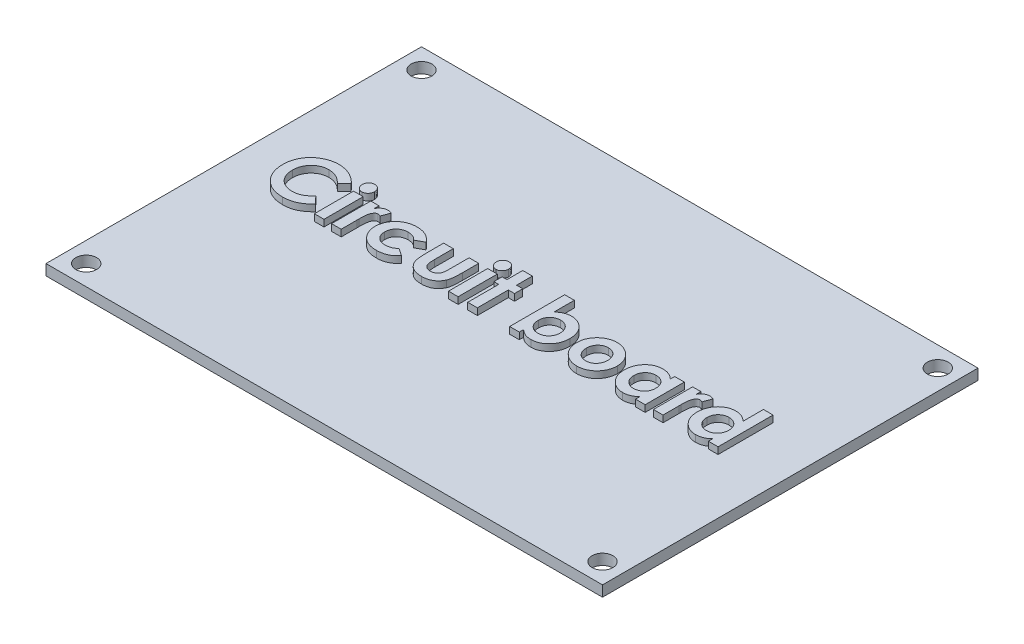
from build123d import *

# Parameters (mm, degrees)
SKETCH_1_W      = 83
SKETCH_1_H      = 56
SKETCH_1_R      = 1.55
EXTRUDE_1_DEPTH = 1.6
SKETCH_2_W      = 1.435897435
SKETCH_2_H      = 5.846153846
EXTRUDE_2_DEPTH = 1


with BuildPart() as part:
    # ｽｹｯﾁ1 → ﾎﾞｽ - 押し出し1 (new body)
    with BuildSketch(Plane(origin=(0, 0, 0), x_dir=(1, 0, 0), z_dir=(0, 1, 0))):
        Rectangle(SKETCH_1_W, SKETCH_1_H)
        with Locations((-38.5, 25)):
            Circle(SKETCH_1_R, mode=Mode.SUBTRACT)
        with Locations((38.5, 25)):
            Circle(SKETCH_1_R, mode=Mode.SUBTRACT)
        with Locations((38.5, -25)):
            Circle(SKETCH_1_R, mode=Mode.SUBTRACT)
        with Locations((-38.5, -25)):
            Circle(SKETCH_1_R, mode=Mode.SUBTRACT)
    extrude(amount=EXTRUDE_1_DEPTH)

    # ｽｹｯﾁ2 → ﾎﾞｽ - 押し出し2 (add)
    # profile 1 of 14: a face of its own
    with BuildSketch(Plane(origin=(0, 1.6, 0), x_dir=(1, 0, 0), z_dir=(0, 1, 0))):
        with BuildLine():
            Line((-28.050815975, 4.060532722), (-29.10370059, 3.054122466))
            add(Edge.make_bspline(
                [(-29.10370059, 3.054122466), (-29.193014841, 3.146473551), (-29.367473554, 3.326864152), (-29.648592194, 3.565685412), (-29.940945343, 3.764710617), (-30.238845856, 3.932328379), (-30.547652099, 4.059143161), (-30.86379343, 4.151555229), (-31.189288505, 4.207895374), (-31.409571052, 4.214341684), (-31.520367257, 4.217584004)],
                knots=[0, 0, 0, 0, 1.115251505, 2.178435587, 3.19620269, 4.182487026, 5.141301733, 6.088180966, 7.038406374, 8, 8, 8, 8], degree=3))
            add(Edge.make_bspline(
                [(-31.520367257, 4.217584004), (-31.612895552, 4.215022458), (-31.795489948, 4.209967528), (-32.063586371, 4.172909904), (-32.320034455, 4.109891803), (-32.565712062, 4.023041187), (-32.799896276, 3.910661099), (-33.023078093, 3.772838518), (-33.234707268, 3.610818179), (-33.431988301, 3.425438382), (-33.612454057, 3.222897024), (-33.771907043, 3.006785877), (-33.905474497, 2.777600041), (-34.015091133, 2.537660542), (-34.100478256, 2.28585682), (-34.161455389, 2.0223584), (-34.196722933, 1.746851475), (-34.201986851, 1.559563921), (-34.204662128, 1.464378876)],
                knots=[0, 0, 0, 0, 1.035432265, 2.043311493, 3.022114605, 3.98653278, 4.95457646, 5.923598177, 6.917315552, 7.932509744, 8.948865224, 9.949768934, 10.933144597, 11.912367597, 12.897413939, 13.903909035, 14.934704909, 16, 16, 16, 16], degree=3))
            add(Edge.make_bspline(
                [(-34.204662128, 1.464378876), (-34.203891144, 1.397571352), (-34.202371518, 1.265892349), (-34.18573652, 1.071102557), (-34.158950252, 0.882110409), (-34.120183886, 0.699202177), (-34.071706163, 0.522219351), (-34.014830757, 0.349635109), (-33.943481395, 0.183834176), (-33.864282528, 0.022890884), (-33.772175158, -0.128803229), (-33.672866422, -0.273456156), (-33.565182311, -0.410358822), (-33.448425349, -0.538951564), (-33.320952328, -0.657224767), (-33.186057953, -0.768735045), (-33.041466743, -0.87069092), (-32.890182223, -0.965651086), (-32.730897487, -1.04814379), (-32.567934299, -1.122866242), (-32.398821808, -1.183551983), (-32.225619061, -1.232470227), (-32.048945023, -1.274067888), (-31.867071658, -1.299680845), (-31.68157558, -1.319077239), (-31.556211367, -1.320274853), (-31.493123667, -1.320877534)],
                knots=[0, 0, 0, 0, 1.103660481, 2.175337485, 3.227646561, 4.255952547, 5.262355991, 6.258840057, 7.255597736, 8.242457506, 9.22035537, 10.185017736, 11.140346927, 12.096287581, 13.051739095, 14.01125915, 14.986044842, 15.97314143, 16.960198552, 17.947847494, 18.933482797, 19.925264591, 20.920966487, 21.929612487, 22.958107872, 24, 24, 24, 24], degree=3))
            add(Edge.make_bspline(
                [(-31.493123667, -1.320877534), (-31.386116085, -1.317782307), (-31.175874014, -1.311700991), (-30.867313544, -1.264145957), (-30.573286156, -1.185920619), (-30.33835968, -1.09354104), (-30.154300991, -1.002315006), (-30.014179832, -0.917935417), (-29.869283633, -0.823547582), (-29.722018996, -0.715589203), (-29.570729485, -0.595355822), (-29.418085709, -0.460214106), (-29.260179961, -0.314614076), (-29.15673747, -0.210696474), (-29.10370059, -0.157415996)],
                knots=[0, 0, 0, 0, 1.404581149, 2.759636711, 4.088442092, 5.392261763, 6.066678138, 6.783632037, 7.538459478, 8.336747902, 9.180226004, 10.074962426, 11.012997595, 12, 12, 12, 12], degree=3))
            Line((-29.10370059, -0.157415996), (-28.082867257, -1.22953138))
            add(Edge.make_bspline(
                [(-28.082867257, -1.22953138), (-28.154626345, -1.298812528), (-28.29468474, -1.434034511), (-28.505958941, -1.626037109), (-28.716967244, -1.798572787), (-28.922612129, -1.957903835), (-29.126262275, -2.099388551), (-29.327896083, -2.223168239), (-29.525230971, -2.332373466), (-29.722364662, -2.425162539), (-29.920523822, -2.503950099), (-30.124406312, -2.571781017), (-30.334635418, -2.629163533), (-30.552495124, -2.675463688), (-30.775953368, -2.712590161), (-31.007101422, -2.737650316), (-31.244473692, -2.754497424), (-31.405486981, -2.756011276), (-31.486713411, -2.75677497)],
                knots=[0, 0, 0, 0, 1.244526981, 2.429050516, 3.560637417, 4.644440555, 5.67424972, 6.652764056, 7.595344123, 8.486817594, 9.369275933, 10.254498637, 11.166417451, 12.086725134, 13.032340136, 13.991389299, 14.986715468, 16, 16, 16, 16], degree=3))
            add(Edge.make_bspline(
                [(-31.486713411, -2.75677497), (-31.6359163, -2.752971491), (-31.92786488, -2.745529139), (-32.355707912, -2.690386353), (-32.762147308, -2.597940444), (-33.148171859, -2.46719643), (-33.513658817, -2.300177079), (-33.858514681, -2.095419197), (-34.182183618, -1.853466794), (-34.482051022, -1.577155787), (-34.75329536, -1.271993476), (-34.993043943, -0.944332872), (-35.191363979, -0.592563643), (-35.356033379, -0.221882545), (-35.484802684, 0.169401984), (-35.575434445, 0.581713195), (-35.631326391, 1.014652976), (-35.637441049, 1.310360826), (-35.640559564, 1.461173748)],
                knots=[0, 0, 0, 0, 1.078019885, 2.10938526, 3.111377082, 4.085535484, 5.04941344, 6.010039228, 6.978205633, 7.964457913, 8.951525778, 9.924444315, 10.892603023, 11.863865945, 12.85144698, 13.863884204, 14.910567087, 16, 16, 16, 16], degree=3))
            add(Edge.make_bspline(
                [(-35.640559564, 1.461173748), (-35.639241831, 1.559532649), (-35.636630405, 1.754455951), (-35.60918408, 2.041593767), (-35.570922306, 2.321501777), (-35.510223482, 2.591273607), (-35.437057035, 2.854543582), (-35.346064946, 3.108450266), (-35.237392541, 3.35372341), (-35.114542588, 3.590773617), (-34.975563666, 3.818047955), (-34.820308952, 4.033593778), (-34.652775309, 4.239075061), (-34.468937176, 4.431765712), (-34.271465962, 4.613357594), (-34.059470108, 4.782866625), (-33.834224662, 4.942723756), (-33.595119969, 5.088806659), (-33.346801196, 5.22094641), (-33.092400296, 5.337499314), (-32.832542302, 5.434910701), (-32.568325918, 5.515709854), (-32.298634833, 5.576020708), (-32.025394033, 5.621674079), (-31.746278567, 5.647194605), (-31.558876712, 5.651372478), (-31.464277513, 5.65348144)],
                knots=[0, 0, 0, 0, 1.071919942, 2.124283339, 3.142214191, 4.149696895, 5.136002878, 6.119640489, 7.086990633, 8.058538607, 9.028339693, 9.988281803, 10.952401235, 11.916291999, 12.888973767, 13.874849856, 14.873389453, 15.898127285, 16.927174885, 17.938320013, 18.946391617, 19.950418109, 20.947802303, 21.956882652, 22.968648068, 24, 24, 24, 24], degree=3))
            add(Edge.make_bspline(
                [(-31.464277513, 5.65348144), (-31.383574697, 5.65227253), (-31.223008148, 5.64986728), (-30.983897613, 5.629816902), (-30.746699373, 5.598327986), (-30.512262669, 5.550817917), (-30.27891057, 5.494417461), (-30.049709585, 5.420568845), (-29.821043945, 5.338250645), (-29.596499929, 5.239856045), (-29.375764109, 5.132449451), (-29.164007567, 5.010592771), (-28.957674932, 4.881784926), (-28.76133841, 4.738402506), (-28.571320195, 4.585646257), (-28.38861391, 4.422803485), (-28.21482291, 4.247159124), (-28.105761327, 4.123056014), (-28.050815975, 4.060532722)],
                knots=[0, 0, 0, 0, 0.996412454, 1.982464992, 2.961075852, 3.949442424, 4.934965278, 5.923860011, 6.921385422, 7.934793307, 8.949617135, 9.951082467, 10.950285876, 11.951772932, 12.951063433, 13.960125323, 14.972308753, 16, 16, 16, 16], degree=3))
        make_face()
    # profile 2 of 14: a face of its own
    with BuildSketch(Plane(origin=(0, 1.6, 0), x_dir=(1, 0, 0), z_dir=(0, 1, 0))):
        with BuildLine():
            add(Edge.make_bspline(
                [(-26.207867257, 5.756045543), (-26.145980087, 5.753009124), (-26.024458668, 5.747046823), (-25.850362697, 5.688927654), (-25.69057788, 5.597711354), (-25.54932367, 5.472560416), (-25.431841627, 5.323107306), (-25.342080982, 5.155784613), (-25.292079067, 4.970396457), (-25.28513454, 4.842332259), (-25.281585205, 4.776878876)],
                knots=[0, 0, 0, 0, 0.989868614, 1.943702388, 2.910836514, 3.924849579, 4.949916355, 5.946401046, 6.950409252, 8, 8, 8, 8], degree=3))
            add(Edge.make_bspline(
                [(-25.281585205, 4.776878876), (-25.285007551, 4.711907849), (-25.291676155, 4.585308708), (-25.343231807, 4.402437284), (-25.429389771, 4.235195859), (-25.547823346, 4.087962405), (-25.687546175, 3.964827097), (-25.843839572, 3.87195482), (-26.016267198, 3.817068807), (-26.135902972, 3.810608091), (-26.196649308, 3.807327594)],
                knots=[0, 0, 0, 0, 1.05296456, 2.051751585, 3.055639087, 4.085634717, 5.099016424, 6.062201612, 7.016062274, 8, 8, 8, 8], degree=3))
            add(Edge.make_bspline(
                [(-26.196649308, 3.807327594), (-26.259076701, 3.810353158), (-26.381655352, 3.816293973), (-26.557179268, 3.874549128), (-26.719095206, 3.96504704), (-26.859736656, 4.092755006), (-26.978564131, 4.243270093), (-27.064403995, 4.414488204), (-27.118098954, 4.601144039), (-27.124472498, 4.731104955), (-27.127739052, 4.797712209)],
                knots=[0, 0, 0, 0, 0.989065327, 1.942068821, 2.907541208, 3.917690034, 4.939857478, 5.938239964, 6.943311734, 8, 8, 8, 8], degree=3))
            add(Edge.make_bspline(
                [(-27.127739052, 4.797712209), (-27.124184148, 4.86157999), (-27.117201054, 4.987039024), (-27.066899621, 5.168305458), (-26.979197186, 5.332815195), (-26.862561377, 5.479532426), (-26.722547855, 5.602348828), (-26.562858958, 5.690794829), (-26.38993466, 5.746513511), (-26.269183035, 5.752835391), (-26.207867257, 5.756045543)],
                knots=[0, 0, 0, 0, 1.038616768, 2.040212704, 3.031499824, 4.052181184, 5.074969369, 6.039807101, 7.004644834, 8, 8, 8, 8], degree=3))
        make_face()
    # profile 3 of 14: a face of its own
    with BuildSketch(Plane(origin=(0, 1.6, 0), x_dir=(1, 0, 0), z_dir=(0, 1, 0))):
        with Locations((-26.204662129, 0.371430158)):
            Rectangle(SKETCH_2_W, SKETCH_2_H)
    # profile 4 of 14: a face of its own
    with BuildSketch(Plane(origin=(0, 1.6, 0), x_dir=(1, 0, 0), z_dir=(0, 1, 0))):
        with BuildLine():
            Line((-24.358508282, 3.294507081), (-23.127739052, 3.294507081))
            Line((-23.127739052, 3.294507081), (-23.127739052, 2.574955799))
            add(Edge.make_bspline(
                [(-23.127739052, 2.574955799), (-23.092922953, 2.63890252), (-23.024873443, 2.763889038), (-22.899860787, 2.931658686), (-22.756241185, 3.072949604), (-22.599175332, 3.190717018), (-22.428187193, 3.282505154), (-22.247855526, 3.347915772), (-22.059723065, 3.39042361), (-21.931385478, 3.39483937), (-21.866521103, 3.397071184)],
                knots=[0, 0, 0, 0, 1.09866127, 2.147379032, 3.14564304, 4.131443017, 5.102343063, 6.064490016, 7.021754664, 8, 8, 8, 8], degree=3))
            add(Edge.make_bspline(
                [(-21.866521103, 3.397071184), (-21.819421473, 3.394865686), (-21.723509807, 3.390374505), (-21.577326933, 3.364267199), (-21.429034896, 3.317060227), (-21.331445957, 3.274556622), (-21.281585205, 3.252840415)],
                knots=[0, 0, 0, 0, 0.931404136, 1.896671404, 2.925354185, 4, 4, 4, 4], degree=3))
            Line((-21.281585205, 3.252840415), (-21.727098026, 2.036494261))
            add(Edge.make_bspline(
                [(-21.727098026, 2.036494261), (-21.76692051, 2.05573456), (-21.841771451, 2.091898915), (-21.95044202, 2.13457658), (-22.049065067, 2.160616406), (-22.111590269, 2.164501776), (-22.140559564, 2.166301953)],
                knots=[0, 0, 0, 0, 1.214386998, 2.282580073, 3.20428172, 4, 4, 4, 4], degree=3))
            add(Edge.make_bspline(
                [(-22.140559564, 2.166301953), (-22.167912213, 2.165109061), (-22.221719586, 2.162762436), (-22.301137764, 2.142652656), (-22.375933149, 2.107973965), (-22.449710127, 2.06354712), (-22.516648513, 2.001790482), (-22.583545553, 1.930296209), (-22.642498806, 1.842027019), (-22.704711586, 1.743778928), (-22.757683543, 1.623523353), (-22.803105365, 1.479962979), (-22.843576573, 1.311436712), (-22.87142629, 1.117049761), (-22.89834416, 0.898683156), (-22.914366336, 0.654734112), (-22.926307868, 0.38597402), (-22.927038012, 0.198369776), (-22.927418539, 0.100596825)],
                knots=[0, 0, 0, 0, 0.544232178, 1.070598461, 1.618251235, 2.182094276, 2.777567932, 3.425210017, 4.127676488, 4.886675562, 5.738955394, 6.734782583, 7.883056018, 9.186093582, 10.642914445, 12.264202625, 14.053029461, 16, 16, 16, 16], degree=3))
            Line((-22.927418539, 0.100596825), (-22.922610846, -0.184659585))
            Line((-22.922610846, -0.184659585), (-22.922610846, -2.551646765))
            Line((-22.922610846, -2.551646765), (-24.358508282, -2.551646765))
            Line((-24.358508282, -2.551646765), (-24.358508282, 3.294507081))
        make_face()
    # profile 5 of 14: a face of its own
    with BuildSketch(Plane(origin=(0, 1.6, 0), x_dir=(1, 0, 0), z_dir=(0, 1, 0))):
        with BuildLine():
            Line((-14.922610846, 2.102199389), (-16.111713411, 1.448353235))
            add(Edge.make_bspline(
                [(-16.111713411, 1.448353235), (-16.166217538, 1.502934317), (-16.270988174, 1.607852878), (-16.43899631, 1.740663132), (-16.604002361, 1.850626327), (-16.772808843, 1.931773516), (-16.946924687, 1.992885128), (-17.132630039, 2.033360691), (-17.332092408, 2.060012411), (-17.470060756, 2.062470434), (-17.54120059, 2.06373785)],
                knots=[0, 0, 0, 0, 1.150764855, 2.212059359, 3.192108068, 4.105322427, 5.000809612, 5.941206042, 6.938435785, 8, 8, 8, 8], degree=3))
            add(Edge.make_bspline(
                [(-17.54120059, 2.06373785), (-17.606440728, 2.06216206), (-17.734110206, 2.059078371), (-17.920655574, 2.036045328), (-18.09794783, 1.999869201), (-18.265668725, 1.946943401), (-18.423519532, 1.877025537), (-18.572805609, 1.794288263), (-18.712076287, 1.695499971), (-18.839362938, 1.582064913), (-18.954261513, 1.457175428), (-19.056756903, 1.323975426), (-19.140724833, 1.180488914), (-19.213320316, 1.030088348), (-19.266693401, 0.869948868), (-19.305742448, 0.701523572), (-19.328000041, 0.524804999), (-19.331224774, 0.404076023), (-19.332867257, 0.342584004)],
                knots=[0, 0, 0, 0, 1.121765476, 2.195200973, 3.227634963, 4.230038321, 5.213228299, 6.192116585, 7.160777141, 8.14345191, 9.118668839, 10.075979138, 11.027630062, 11.972829041, 12.943187208, 13.923755399, 14.94248691, 16, 16, 16, 16], degree=3))
            add(Edge.make_bspline(
                [(-19.332867257, 0.342584004), (-19.331131832, 0.282696724), (-19.327743292, 0.165762568), (-19.306925245, -0.006041573), (-19.270784333, -0.169591785), (-19.216595765, -0.324023424), (-19.151644708, -0.470760132), (-19.070078072, -0.608634881), (-18.9741602, -0.738249738), (-18.863386126, -0.858478159), (-18.740676562, -0.966608872), (-18.608386031, -1.062099487), (-18.466909233, -1.143057862), (-18.314598104, -1.206591991), (-18.153935924, -1.258359015), (-17.983849785, -1.295219163), (-17.804520688, -1.315679095), (-17.682276582, -1.319117935), (-17.619726231, -1.320877534)],
                knots=[0, 0, 0, 0, 1.070556293, 2.090336998, 3.088792742, 4.058148387, 5.011235098, 5.952916408, 6.915475435, 7.888633318, 8.869583867, 9.83422472, 10.800707077, 11.776204622, 12.778807041, 13.814557445, 14.881744048, 16, 16, 16, 16], degree=3))
            add(Edge.make_bspline(
                [(-17.619726231, -1.320877534), (-17.542711757, -1.319115218), (-17.392390695, -1.315675432), (-17.173867496, -1.286500278), (-16.968240156, -1.238254831), (-16.775486868, -1.171479302), (-16.595877299, -1.084169053), (-16.42987294, -0.977526097), (-16.275767274, -0.852337124), (-16.185901339, -0.754736981), (-16.140559564, -0.705492919)],
                knots=[0, 0, 0, 0, 1.116373375, 2.178998604, 3.189797796, 4.174590301, 5.13072713, 6.078291395, 7.030403691, 8, 8, 8, 8], degree=3))
            Line((-16.140559564, -0.705492919), (-15.025174949, -1.47151856))
            add(Edge.make_bspline(
                [(-15.025174949, -1.47151856), (-15.102488053, -1.566043606), (-15.255059585, -1.752581598), (-15.521254601, -1.993022259), (-15.80776084, -2.199614213), (-16.120340561, -2.364513292), (-16.454441571, -2.49566943), (-16.812674548, -2.588383798), (-17.194433567, -2.642960796), (-17.456618944, -2.650400902), (-17.590880077, -2.654210867)],
                knots=[0, 0, 0, 0, 0.997876357, 1.969233105, 2.924898516, 3.881013542, 4.852507933, 5.855329832, 6.901747111, 8, 8, 8, 8], degree=3))
            add(Edge.make_bspline(
                [(-17.590880077, -2.654210867), (-17.711723424, -2.651417328), (-17.947743805, -2.645961237), (-18.291737646, -2.604177875), (-18.615281716, -2.533799489), (-18.919041595, -2.436058377), (-19.202740342, -2.309447036), (-19.465457896, -2.152401667), (-19.708966282, -1.969290698), (-19.928871632, -1.759249121), (-20.125077662, -1.530616597), (-20.296366234, -1.289830198), (-20.444504426, -1.041204114), (-20.560718692, -0.780600061), (-20.655697778, -0.512079995), (-20.719843671, -0.232434141), (-20.762151838, 0.056034022), (-20.766542666, 0.25161894), (-20.768764693, 0.350596825)],
                knots=[0, 0, 0, 0, 1.183377041, 2.311265848, 3.387807024, 4.421911742, 5.431260577, 6.423665966, 7.413571885, 8.409103097, 9.395976332, 10.359992013, 11.300391101, 12.225292883, 13.150239058, 14.085544813, 15.031169026, 16, 16, 16, 16], degree=3))
            add(Edge.make_bspline(
                [(-20.768764693, 0.350596825), (-20.767574337, 0.419555557), (-20.765216608, 0.556141602), (-20.745089062, 0.758987111), (-20.713777364, 0.958390413), (-20.666719577, 1.152951801), (-20.608846807, 1.343615216), (-20.538494619, 1.530342332), (-20.452888061, 1.712169606), (-20.357393688, 1.890643768), (-20.248556696, 2.061053366), (-20.129817796, 2.223323187), (-20.00134428, 2.376459405), (-19.861626909, 2.519034832), (-19.711639881, 2.652069651), (-19.553563619, 2.778262893), (-19.382282851, 2.891106483), (-19.20375196, 2.9972003), (-19.016433084, 3.091644232), (-18.8224792, 3.173161796), (-18.623389137, 3.242422723), (-18.418685685, 3.298109907), (-18.209247475, 3.344006355), (-17.993210875, 3.373134128), (-17.772363225, 3.393607414), (-17.622979977, 3.395909633), (-17.547610846, 3.397071184)],
                knots=[0, 0, 0, 0, 1.00272354, 1.986087015, 2.96193297, 3.936200312, 4.894695956, 5.858592327, 6.835334787, 7.815655071, 8.800643866, 9.773423113, 10.738352213, 11.705312252, 12.673769326, 13.65298065, 14.64420052, 15.654211674, 16.672258995, 17.692438602, 18.712115155, 19.735602823, 20.776372304, 21.827874031, 22.90408564, 24, 24, 24, 24], degree=3))
            add(Edge.make_bspline(
                [(-17.547610846, 3.397071184), (-17.477602593, 3.396279681), (-17.339531515, 3.39471867), (-17.135631743, 3.37839613), (-16.937293942, 3.350671579), (-16.744180579, 3.313993166), (-16.55570517, 3.268542225), (-16.374393787, 3.207957643), (-16.197767596, 3.139196423), (-15.970271197, 3.035374162), (-15.702094581, 2.880402632), (-15.407708505, 2.658139296), (-15.145227681, 2.39812361), (-14.997210869, 2.201365086), (-14.922610846, 2.102199389)],
                knots=[0, 0, 0, 0, 0.826738014, 1.630502179, 2.413926014, 3.191023582, 3.95155221, 4.701751672, 5.446919844, 6.189438973, 7.653650558, 9.094719814, 10.535747635, 12, 12, 12, 12], degree=3))
        make_face()
    # profile 6 of 14: a face of its own
    with BuildSketch(Plane(origin=(0, 1.6, 0), x_dir=(1, 0, 0), z_dir=(0, 1, 0))):
        with BuildLine():
            Line((-13.486713411, 3.294507081), (-12.050815975, 3.294507081))
            Line((-12.050815975, 3.294507081), (-12.050815975, 0.488417338))
            add(Edge.make_bspline(
                [(-12.050815975, 0.488417338), (-12.050688466, 0.422705489), (-12.050443746, 0.296588405), (-12.043633992, 0.115459581), (-12.034078561, -0.050174435), (-12.022154029, -0.200508955), (-12.004355901, -0.335182374), (-11.983808712, -0.453937598), (-11.960514829, -0.557630271), (-11.922636033, -0.673209581), (-11.863373973, -0.799688906), (-11.773877772, -0.933961563), (-11.665471769, -1.05006815), (-11.539620603, -1.149039054), (-11.395039023, -1.227030299), (-11.233718986, -1.279883776), (-11.057690225, -1.315406808), (-10.935086457, -1.319005898), (-10.871328795, -1.320877534)],
                knots=[0, 0, 0, 0, 1.267339619, 2.432334223, 3.495366327, 4.467371443, 5.340232306, 6.114347373, 6.791623365, 7.387877112, 8.457231658, 9.474542289, 10.487879852, 11.508108106, 12.54995813, 13.638205937, 14.771795776, 16, 16, 16, 16], degree=3))
            add(Edge.make_bspline(
                [(-10.871328795, -1.320877534), (-10.807627713, -1.318741327), (-10.684706871, -1.314619192), (-10.507506923, -1.282473691), (-10.345806914, -1.227391304), (-10.197946081, -1.152678547), (-10.068284849, -1.052688248), (-9.955394117, -0.933542712), (-9.86034277, -0.793319976), (-9.814666215, -0.688717834), (-9.79120059, -0.634980098)],
                knots=[0, 0, 0, 0, 1.116871431, 2.155171802, 3.144773418, 4.104381479, 5.046960687, 6.001340237, 6.973219418, 8, 8, 8, 8], degree=3))
            add(Edge.make_bspline(
                [(-9.79120059, -0.634980098), (-9.782589494, -0.611109314), (-9.763581493, -0.558417312), (-9.746663996, -0.467516357), (-9.728455731, -0.360313398), (-9.714052347, -0.23462373), (-9.705902404, -0.09122576), (-9.697170575, 0.070061241), (-9.692720677, 0.249076643), (-9.692143609, 0.374633578), (-9.691841616, 0.440340415)],
                knots=[0, 0, 0, 0, 0.56094539, 1.238222264, 2.041156151, 2.969685991, 4.036367568, 5.220421584, 6.545382566, 8, 8, 8, 8], degree=3))
            Line((-9.691841616, 0.440340415), (-9.691841616, 3.294507081))
            Line((-9.691841616, 3.294507081), (-8.25594418, 3.294507081))
            Line((-8.25594418, 3.294507081), (-8.25594418, 0.837776312))
            add(Edge.make_bspline(
                [(-8.25594418, 0.837776312), (-8.256192804, 0.715966391), (-8.256669492, 0.482419903), (-8.270331075, 0.147405057), (-8.289185608, -0.157190306), (-8.313466619, -0.432204831), (-8.348452556, -0.677752652), (-8.391399658, -0.893257953), (-8.438912864, -1.080144821), (-8.482484245, -1.190876582), (-8.502739052, -1.242351893)],
                knots=[0, 0, 0, 0, 1.388070971, 2.661352173, 3.82033814, 4.865898334, 5.806910977, 6.645039373, 7.370126333, 8, 8, 8, 8], degree=3))
            add(Edge.make_bspline(
                [(-8.502739052, -1.242351893), (-8.528700497, -1.297755232), (-8.579946159, -1.407116663), (-8.66886691, -1.562604399), (-8.76472846, -1.70991671), (-8.872091938, -1.845586009), (-8.988765724, -1.970991157), (-9.111451815, -2.088982918), (-9.245675356, -2.194756489), (-9.387955435, -2.291033722), (-9.540277372, -2.37649821), (-9.701597874, -2.452234223), (-9.873660266, -2.51387035), (-10.054972561, -2.566115662), (-10.246370492, -2.605077678), (-10.44746851, -2.634588433), (-10.65848717, -2.649839703), (-10.802397988, -2.652729939), (-10.876136487, -2.654210867)],
                knots=[0, 0, 0, 0, 0.997311338, 1.968606903, 2.91805772, 3.860812155, 4.785445165, 5.709667791, 6.633356648, 7.568312411, 8.508286151, 9.478643871, 10.470653671, 11.485274776, 12.552984541, 13.653035246, 14.797438149, 16, 16, 16, 16], degree=3))
            add(Edge.make_bspline(
                [(-10.876136487, -2.654210867), (-10.955794788, -2.653261551), (-11.111659069, -2.65140406), (-11.339374607, -2.628657075), (-11.556390576, -2.599225434), (-11.760284007, -2.549186249), (-11.953902365, -2.49121335), (-12.135022804, -2.417224511), (-12.304385425, -2.3302346), (-12.462323474, -2.230759342), (-12.60761204, -2.117887152), (-12.743481776, -1.99649704), (-12.865546225, -1.86175928), (-12.977790293, -1.717834626), (-13.078961273, -1.56339847), (-13.169109381, -1.398999939), (-13.248310976, -1.223891266), (-13.290568956, -1.10116509), (-13.312033923, -1.038826252)],
                knots=[0, 0, 0, 0, 1.211240017, 2.369985978, 3.478996442, 4.539426614, 5.559871561, 6.551301256, 7.510778031, 8.453136967, 9.386094087, 10.30661716, 11.221130616, 12.147659962, 13.080758632, 14.026335491, 14.997475882, 16, 16, 16, 16], degree=3))
            add(Edge.make_bspline(
                [(-13.312033923, -1.038826252), (-13.326678024, -0.990411524), (-13.35822483, -0.886114915), (-13.392285715, -0.712786123), (-13.41952885, -0.513014985), (-13.44603011, -0.286604998), (-13.464517874, -0.033176587), (-13.476601695, 0.246867773), (-13.48476636, 0.554075705), (-13.486045273, 0.767792025), (-13.486713411, 0.879442979)],
                knots=[0, 0, 0, 0, 0.627914866, 1.352675004, 2.190563461, 3.132055958, 4.183353232, 5.345633452, 6.613289997, 8, 8, 8, 8], degree=3))
            Line((-13.486713411, 0.879442979), (-13.486713411, 3.294507081))
        make_face()
    # profile 7 of 14: a face of its own
    with BuildSketch(Plane(origin=(0, 1.6, 0), x_dir=(1, 0, 0), z_dir=(0, 1, 0))):
        with BuildLine():
            add(Edge.make_bspline(
                [(-6.207867257, 5.756045543), (-6.145980087, 5.753009124), (-6.024458668, 5.747046823), (-5.850362697, 5.688927654), (-5.69057788, 5.597711354), (-5.54932367, 5.472560416), (-5.431841627, 5.323107306), (-5.342080982, 5.155784613), (-5.292079067, 4.970396457), (-5.28513454, 4.842332259), (-5.281585205, 4.776878876)],
                knots=[0, 0, 0, 0, 0.989868614, 1.943702388, 2.910836514, 3.924849579, 4.949916355, 5.946401046, 6.950409252, 8, 8, 8, 8], degree=3))
            add(Edge.make_bspline(
                [(-5.281585205, 4.776878876), (-5.285007551, 4.711907849), (-5.291676155, 4.585308708), (-5.343231807, 4.402437284), (-5.429389771, 4.235195859), (-5.547823346, 4.087962405), (-5.687546175, 3.964827097), (-5.843839572, 3.87195482), (-6.016267198, 3.817068807), (-6.135902972, 3.810608091), (-6.196649308, 3.807327594)],
                knots=[0, 0, 0, 0, 1.05296456, 2.051751585, 3.055639087, 4.085634717, 5.099016424, 6.062201612, 7.016062274, 8, 8, 8, 8], degree=3))
            add(Edge.make_bspline(
                [(-6.196649308, 3.807327594), (-6.259076701, 3.810353158), (-6.381655352, 3.816293973), (-6.557179268, 3.874549128), (-6.719095206, 3.96504704), (-6.859736656, 4.092755006), (-6.978564131, 4.243270093), (-7.064403995, 4.414488204), (-7.118098954, 4.601144039), (-7.124472498, 4.731104955), (-7.127739052, 4.797712209)],
                knots=[0, 0, 0, 0, 0.989065327, 1.942068821, 2.907541208, 3.917690034, 4.939857478, 5.938239964, 6.943311734, 8, 8, 8, 8], degree=3))
            add(Edge.make_bspline(
                [(-7.127739052, 4.797712209), (-7.124184148, 4.86157999), (-7.117201054, 4.987039024), (-7.066899621, 5.168305458), (-6.979197186, 5.332815195), (-6.862561377, 5.479532426), (-6.722547855, 5.602348828), (-6.562858958, 5.690794829), (-6.38993466, 5.746513511), (-6.269183035, 5.752835391), (-6.207867257, 5.756045543)],
                knots=[0, 0, 0, 0, 1.038616768, 2.040212704, 3.031499824, 4.052181184, 5.074969369, 6.039807101, 7.004644834, 8, 8, 8, 8], degree=3))
        make_face()
    # profile 8 of 14: a face of its own
    with BuildSketch(Plane(origin=(0, 1.6, 0), x_dir=(1, 0, 0), z_dir=(0, 1, 0))):
        with Locations((-6.204662129, 0.371430158)):
            Rectangle(SKETCH_2_W, SKETCH_2_H)
    # profile 9 of 14: a face of its own
    with BuildSketch(Plane(origin=(0, 1.6, 0), x_dir=(1, 0, 0), z_dir=(0, 1, 0))):
        Polygon((-4.050815975, 5.65348144), (-2.614918539, 5.65348144), (-2.614918539, 3.294507081), (-1.691841616, 3.294507081), (-1.691841616, 2.06373785), (-2.614918539, 2.06373785), (-2.614918539, -2.551646765), (-4.050815975, -2.551646765), (-4.050815975, 2.06373785), (-4.768764693, 2.06373785), (-4.768764693, 3.294507081), (-4.050815975, 3.294507081), align=None)
    # profile 10 of 14: a face of its own
    with BuildSketch(Plane(origin=(0, 1.6, 0), x_dir=(1, 0, 0), z_dir=(0, 1, 0))):
        with BuildLine():
            Line((3.641491718, 5.65348144), (3.641491718, 2.613417338))
            add(Edge.make_bspline(
                [(3.641491718, 2.613417338), (3.708168228, 2.67619729), (3.839057767, 2.799437681), (4.052763646, 2.958800994), (4.274137484, 3.093302324), (4.502980961, 3.206142648), (4.74135369, 3.289583202), (4.986326831, 3.354419638), (5.240410553, 3.388758382), (5.412236637, 3.394284943), (5.498863513, 3.397071184)],
                knots=[0, 0, 0, 0, 1.061187343, 2.083167259, 3.083809127, 4.061667593, 5.035358583, 6.007314429, 6.995378812, 8, 8, 8, 8], degree=3))
            add(Edge.make_bspline(
                [(5.498863513, 3.397071184), (5.5930281, 3.394815705), (5.778501784, 3.390373142), (6.051391019, 3.348895441), (6.312906077, 3.281849591), (6.564044184, 3.188235311), (6.803467302, 3.066692803), (7.033865523, 2.921168599), (7.251265357, 2.74565757), (7.45577249, 2.546861903), (7.644946683, 2.328967083), (7.809493392, 2.092069169), (7.946554414, 1.839286192), (8.062720365, 1.573606574), (8.147502942, 1.290624107), (8.212846278, 0.994134811), (8.249259252, 0.681630324), (8.254304395, 0.468740328), (8.256876333, 0.360212209)],
                knots=[0, 0, 0, 0, 0.985987466, 1.942075377, 2.884088208, 3.810275091, 4.743821533, 5.692411115, 6.659945104, 7.665215984, 8.677116751, 9.678438675, 10.680260931, 11.685531812, 12.710472044, 13.769734641, 14.863044265, 16, 16, 16, 16], degree=3))
            add(Edge.make_bspline(
                [(8.256876333, 0.360212209), (8.254442165, 0.255399298), (8.249643884, 0.04878994), (8.210876794, -0.2545296), (8.145169824, -0.544285745), (8.052996261, -0.82058285), (7.935818829, -1.084294062), (7.792795685, -1.335237667), (7.623092546, -1.572537128), (7.429078064, -1.792995778), (7.217089049, -1.992637475), (6.99621169, -2.17175577), (6.762046836, -2.318529167), (6.520448087, -2.442490544), (6.267609345, -2.537281411), (6.00525761, -2.603693067), (5.733808384, -2.648093379), (5.549255973, -2.652151395), (5.455594282, -2.654210867)],
                knots=[0, 0, 0, 0, 1.098553145, 2.165490463, 3.199345634, 4.208780719, 5.21409072, 6.219899742, 7.23156933, 8.267303578, 9.293302409, 10.281606823, 11.243293419, 12.184993323, 13.124258899, 14.066907486, 15.018941492, 16, 16, 16, 16], degree=3))
            add(Edge.make_bspline(
                [(5.455594282, -2.654210867), (5.372162778, -2.651980523), (5.207880082, -2.647588813), (4.96572055, -2.615016511), (4.733014032, -2.560236175), (4.50682089, -2.484775908), (4.286527391, -2.381674998), (4.068297118, -2.252760797), (3.850725587, -2.096402244), (3.712640279, -1.975909983), (3.641491718, -1.913826252)],
                knots=[0, 0, 0, 0, 0.996418773, 1.962021009, 2.912343664, 3.848616743, 4.805003894, 5.811808768, 6.872532775, 8, 8, 8, 8], degree=3))
            Line((3.641491718, -1.913826252), (3.641491718, -2.551646765))
            Line((3.641491718, -2.551646765), (2.205594282, -2.551646765))
            Line((2.205594282, -2.551646765), (2.205594282, 5.65348144))
            Line((2.205594282, 5.65348144), (3.641491718, 5.65348144))
        make_face()
        with BuildLine():
            add(Edge.make_bspline(
                [(5.187966077, 2.06373785), (5.129693075, 2.061945916), (5.015446313, 2.058432749), (4.847711259, 2.038298808), (4.688779342, 2.00041665), (4.536234131, 1.951317494), (4.392007287, 1.885041345), (4.254918871, 1.804701029), (4.12614306, 1.708901335), (4.005011508, 1.601435813), (3.896165178, 1.480536898), (3.799464656, 1.351350138), (3.719238692, 1.212193275), (3.652361607, 1.064830805), (3.601905768, 0.907668278), (3.564482153, 0.74204268), (3.544144791, 0.567446443), (3.540694179, 0.448401596), (3.538927615, 0.387455799)],
                knots=[0, 0, 0, 0, 1.060469436, 2.079096586, 3.066888298, 4.028858836, 4.99004353, 5.948472697, 6.914558426, 7.905691313, 8.889602648, 9.869280844, 10.836099585, 11.806137001, 12.808075328, 13.83377171, 14.890985086, 16, 16, 16, 16], degree=3))
            add(Edge.make_bspline(
                [(3.538927615, 0.387455799), (3.540716408, 0.325443401), (3.54422699, 0.203741399), (3.564394814, 0.02542213), (3.601555753, -0.143521713), (3.653074286, -0.30347317), (3.718813368, -0.454452994), (3.79894428, -0.597020889), (3.896709224, -0.728051126), (4.004359837, -0.852137624), (4.126240375, -0.961041058), (4.254436049, -1.058712457), (4.391973982, -1.13917253), (4.536890091, -1.204364207), (4.688084765, -1.258538134), (4.847811094, -1.2951434), (5.015419822, -1.315650735), (5.129684127, -1.319112048), (5.187966077, -1.320877534)],
                knots=[0, 0, 0, 0, 1.117193555, 2.192540452, 3.22680955, 4.227918444, 5.21468246, 6.188555072, 7.166222992, 8.154674427, 9.142376254, 10.104580718, 11.053462639, 12.005072638, 12.963662044, 13.941614018, 14.950094269, 16, 16, 16, 16], degree=3))
            add(Edge.make_bspline(
                [(5.187966077, -1.320877534), (5.244128039, -1.319237451), (5.355296507, -1.315991028), (5.517954809, -1.293338626), (5.674309962, -1.256322348), (5.823137498, -1.203560763), (5.965343387, -1.134865233), (6.102222233, -1.054480092), (6.229048462, -0.954044861), (6.350797678, -0.843657967), (6.459730701, -0.719173299), (6.557456714, -0.586924734), (6.639549468, -0.445731928), (6.704729181, -0.295126665), (6.758615108, -0.137961626), (6.79540473, 0.028639851), (6.815645706, 0.20319073), (6.819183505, 0.322234682), (6.820978897, 0.382648107)],
                knots=[0, 0, 0, 0, 1.021711385, 2.02240246, 2.981887075, 3.941027022, 4.888772411, 5.852236371, 6.822344989, 7.82661704, 8.838806642, 9.826383926, 10.814965113, 11.80282933, 12.807900643, 13.833672313, 14.900613836, 16, 16, 16, 16], degree=3))
            add(Edge.make_bspline(
                [(6.820978897, 0.382648107), (6.819154833, 0.442518014), (6.815560917, 0.560478493), (6.795734434, 0.733575831), (6.757528355, 0.897755209), (6.709288318, 1.054357855), (6.641892662, 1.201345208), (6.562204093, 1.340456107), (6.468435729, 1.472110587), (6.359660386, 1.59275462), (6.240353006, 1.702532024), (6.112994411, 1.799631042), (5.978084748, 1.882289973), (5.833786844, 1.947475902), (5.683505901, 2.001109874), (5.524945313, 2.038053662), (5.358911188, 2.058500421), (5.245713095, 2.061968593), (5.187966077, 2.06373785)],
                knots=[0, 0, 0, 0, 1.094680664, 2.156827393, 3.177782763, 4.17210342, 5.146667393, 6.126451192, 7.099203661, 8.094961544, 9.09004898, 10.058676268, 11.018205477, 11.974998356, 12.947750825, 13.930643515, 14.944335875, 16, 16, 16, 16], degree=3))
        make_face(mode=Mode.SUBTRACT)
    # profile 11 of 14: a face of its own
    with BuildSketch(Plane(origin=(0, 1.6, 0), x_dir=(1, 0, 0), z_dir=(0, 1, 0))):
        with BuildLine():
            add(Edge.make_bspline(
                [(12.272901974, 3.397071184), (12.340788433, 3.395863098), (12.475234382, 3.39347054), (12.675474828, 3.373554682), (12.872214609, 3.341061139), (13.066584559, 3.298987673), (13.256779772, 3.240036454), (13.443797799, 3.169333582), (13.629310818, 3.088158417), (13.808714433, 2.991531577), (13.983304701, 2.886730957), (14.148826666, 2.771127274), (14.303905782, 2.645628556), (14.451420845, 2.513144589), (14.584497415, 2.367907454), (14.711639799, 2.216915285), (14.825978803, 2.05475856), (14.93184025, 1.885388662), (15.026087935, 1.709785025), (15.107924717, 1.529169211), (15.178951349, 1.34603836), (15.234563779, 1.158161813), (15.280605744, 0.968016973), (15.309661497, 0.773273757), (15.330318123, 0.575932666), (15.332634385, 0.443066405), (15.33379941, 0.37623785)],
                knots=[0, 0, 0, 0, 1.022364134, 2.024744242, 3.027414945, 4.024939316, 5.017584196, 6.023349371, 7.035562955, 8.064994934, 9.090267829, 10.101425541, 11.102933353, 12.093946398, 13.084502048, 14.067315274, 15.065326281, 16.070028806, 17.074376865, 18.064572984, 19.055292013, 20.030201733, 21.013838017, 21.999348303, 22.993720005, 24, 24, 24, 24], degree=3))
            add(Edge.make_bspline(
                [(15.33379941, 0.37623785), (15.33256992, 0.308887198), (15.330125414, 0.174978833), (15.310408828, -0.024218495), (15.277790911, -0.219877498), (15.235555965, -0.413150837), (15.176825358, -0.601565395), (15.108204912, -0.787898476), (15.023970616, -0.969610291), (14.930843395, -1.148683146), (14.824301303, -1.319847472), (14.710061272, -1.483628616), (14.583451423, -1.635729831), (14.451440168, -1.780868198), (14.307765915, -1.914135786), (14.154721972, -2.037696507), (13.993633275, -2.153060945), (13.823341427, -2.257522433), (13.646027581, -2.349309017), (13.464682103, -2.432062113), (13.278244585, -2.500959975), (13.087100869, -2.557144283), (12.891135034, -2.600646387), (12.690779721, -2.630197884), (12.486466421, -2.650750609), (12.348808165, -2.653050023), (12.279312231, -2.654210867)],
                knots=[0, 0, 0, 0, 1.012026251, 2.012137606, 3.004615893, 3.992048833, 4.982446996, 5.968083444, 6.973977695, 7.990229942, 8.999482246, 10.001782172, 10.988562221, 11.971415814, 12.948383116, 13.930088534, 14.925840678, 15.924049238, 16.929462851, 17.924729459, 18.917889337, 19.913673841, 20.916777188, 21.931792057, 22.95587778, 24, 24, 24, 24], degree=3))
            add(Edge.make_bspline(
                [(12.279312231, -2.654210867), (12.177695003, -2.651228201), (11.9774059, -2.645349321), (11.682427405, -2.605080531), (11.399050445, -2.535767384), (11.126813262, -2.439146386), (10.865362211, -2.315330177), (10.61697903, -2.162088817), (10.379192981, -1.982439188), (10.1561227, -1.777899705), (9.951760103, -1.55350137), (9.773224787, -1.313957515), (9.621633856, -1.062858499), (9.497123696, -0.799917986), (9.401027242, -0.524775412), (9.331629206, -0.238253357), (9.291311182, 0.06045355), (9.285482023, 0.263403639), (9.282517359, 0.366622466)],
                knots=[0, 0, 0, 0, 1.029999031, 2.030143771, 3.011211297, 3.982305373, 4.953580601, 5.938004764, 6.935448627, 7.970290061, 9.001484052, 10.007591832, 10.993831261, 11.969999897, 12.951306496, 13.942897864, 14.953773953, 16, 16, 16, 16], degree=3))
            add(Edge.make_bspline(
                [(9.282517359, 0.366622466), (9.28558541, 0.476837546), (9.291615603, 0.69346308), (9.339497992, 1.010824424), (9.415961, 1.31468287), (9.525718833, 1.60418843), (9.665924811, 1.879875058), (9.837084534, 2.141161301), (10.040043886, 2.388106343), (10.195470109, 2.537467169), (10.274504538, 2.613417338)],
                knots=[0, 0, 0, 0, 1.043912699, 2.05178951, 3.033892, 4.007821512, 4.978932272, 5.95884105, 6.962068106, 8, 8, 8, 8], degree=3))
            add(Edge.make_bspline(
                [(10.274504538, 2.613417338), (10.347026528, 2.676371484), (10.490097399, 2.800566983), (10.722540478, 2.958088613), (10.960535962, 3.094139243), (11.206936329, 3.205998166), (11.462428479, 3.290337989), (11.725703161, 3.351729834), (11.996705629, 3.389438504), (12.18036866, 3.394514028), (12.272901974, 3.397071184)],
                knots=[0, 0, 0, 0, 1.048115528, 2.067714963, 3.060638214, 4.039924844, 5.017819947, 5.994373833, 6.98952318, 8, 8, 8, 8], degree=3))
        make_face()
        with BuildLine():
            add(Edge.make_bspline(
                [(12.304953256, 2.06373785), (12.249359248, 2.06189009), (12.139921844, 2.058252753), (11.97882711, 2.038732138), (11.826462015, 1.99872296), (11.679800303, 1.947842236), (11.541436434, 1.879796437), (11.407581115, 1.800167171), (11.285194528, 1.700520943), (11.168353995, 1.591216321), (11.062288834, 1.469836472), (10.971911246, 1.337593217), (10.891156868, 1.199545906), (10.829924919, 1.050640455), (10.779249627, 0.894946882), (10.744953197, 0.729949652), (10.721085277, 0.557491876), (10.719313422, 0.439357116), (10.718414795, 0.379442979)],
                knots=[0, 0, 0, 0, 1.030650113, 2.02884584, 2.99876339, 3.944280128, 4.900564847, 5.851248946, 6.823638398, 7.81794922, 8.81432732, 9.802856497, 10.78262424, 11.771747962, 12.779760563, 13.812642396, 14.89064281, 16, 16, 16, 16], degree=3))
            add(Edge.make_bspline(
                [(10.718414795, 0.379442979), (10.719466311, 0.317415967), (10.721521298, 0.196196084), (10.74280112, 0.019198754), (10.777892247, -0.148770538), (10.827745742, -0.307452318), (10.890444929, -0.457985582), (10.967369562, -0.599525738), (11.059331492, -0.73122176), (11.163594, -0.852911473), (11.277756993, -0.963370572), (11.402847877, -1.058162438), (11.533628315, -1.140523988), (11.673112198, -1.206673025), (11.819318456, -1.257745448), (11.972681115, -1.295348356), (12.134006095, -1.31560698), (12.244004237, -1.319096525), (12.300145564, -1.320877534)],
                knots=[0, 0, 0, 0, 1.141730614, 2.231293227, 3.276944405, 4.297399982, 5.28939179, 6.275415646, 7.257752684, 8.24146775, 9.222424823, 10.176631434, 11.126518621, 12.063689483, 13.012557477, 13.974037417, 14.965980454, 16, 16, 16, 16], degree=3))
            add(Edge.make_bspline(
                [(12.300145564, -1.320877534), (12.35631497, -1.319297859), (12.466439613, -1.31620078), (12.62795404, -1.293008545), (12.782099881, -1.256508538), (12.929554855, -1.204996552), (13.069126775, -1.13743163), (13.201349933, -1.054676052), (13.327387515, -0.958565716), (13.443082587, -0.846022464), (13.550179302, -0.723953244), (13.644096716, -0.591562009), (13.722577649, -0.450021816), (13.786946067, -0.30022324), (13.836897292, -0.142372175), (13.871407479, 0.024118089), (13.89528816, 0.198731588), (13.897019942, 0.318461919), (13.897901974, 0.379442979)],
                knots=[0, 0, 0, 0, 1.031504075, 2.022346795, 2.991027682, 3.937587355, 4.885570121, 5.833146507, 6.798790848, 7.791235734, 8.792807298, 9.778388351, 10.766749885, 11.760164525, 12.768777521, 13.802286646, 14.880660483, 16, 16, 16, 16], degree=3))
            add(Edge.make_bspline(
                [(13.897901974, 0.379442979), (13.896837081, 0.440402726), (13.894747415, 0.560025524), (13.873466077, 0.734875185), (13.838719324, 0.900827307), (13.788222829, 1.057173287), (13.725896317, 1.205696785), (13.648918515, 1.345637565), (13.556503058, 1.476306384), (13.4517337, 1.597055311), (13.335859332, 1.705964418), (13.212940328, 1.803084903), (13.080165909, 1.883411005), (12.940027002, 1.949628388), (12.792150765, 2.000573212), (12.636703213, 2.038389225), (12.473207948, 2.058359577), (12.361624308, 2.061926356), (12.304953256, 2.06373785)],
                knots=[0, 0, 0, 0, 1.123894411, 2.205445421, 3.243160173, 4.246488011, 5.231014757, 6.210004299, 7.185865357, 8.177612767, 9.153374344, 10.115157457, 11.061423229, 12.009021698, 12.96873347, 13.94135618, 14.954456845, 16, 16, 16, 16], degree=3))
        make_face(mode=Mode.SUBTRACT)
    # profile 12 of 14: a face of its own
    with BuildSketch(Plane(origin=(0, 1.6, 0), x_dir=(1, 0, 0), z_dir=(0, 1, 0))):
        with BuildLine():
            Line((20.974825051, 3.294507081), (22.410722487, 3.294507081))
            Line((22.410722487, 3.294507081), (22.410722487, -2.551646765))
            Line((22.410722487, -2.551646765), (20.974825051, -2.551646765))
            Line((20.974825051, -2.551646765), (20.974825051, -1.913826252))
            add(Edge.make_bspline(
                [(20.974825051, -1.913826252), (20.903676862, -1.97591102), (20.765592278, -2.096405293), (20.548015654, -2.252749677), (20.329803247, -2.381713588), (20.109906539, -2.484426309), (19.884945811, -2.560269082), (19.653301434, -2.615181022), (19.411637484, -2.647563935), (19.24735766, -2.651972144), (19.163927615, -2.654210867)],
                knots=[0, 0, 0, 0, 1.129196829, 2.191548051, 3.199897424, 4.157751732, 5.089409408, 6.034969131, 7.002052659, 8, 8, 8, 8], degree=3))
            add(Edge.make_bspline(
                [(19.163927615, -2.654210867), (19.070273681, -2.652103947), (18.8852082, -2.647940552), (18.613645151, -2.604114108), (18.35142403, -2.537027966), (18.098757687, -2.44209269), (17.856105825, -2.319075185), (17.621611421, -2.171185147), (17.399294425, -1.993230754), (17.187304124, -1.792911637), (16.993207075, -1.572559183), (16.823525603, -1.335231854), (16.680496733, -1.084295614), (16.563320833, -0.820582433), (16.471146855, -0.54428586), (16.405439999, -0.254529568), (16.366672878, 0.048789931), (16.361874601, 0.255399295), (16.359440436, 0.360212209)],
                knots=[0, 0, 0, 0, 0.980476535, 1.937477201, 2.874147792, 3.812856188, 4.758993464, 5.720109578, 6.712210464, 7.737600662, 8.772720504, 9.783789959, 10.789002326, 11.793715968, 12.802552247, 13.835794126, 14.902098527, 16, 16, 16, 16], degree=3))
            add(Edge.make_bspline(
                [(16.359440436, 0.360212209), (16.361995102, 0.46874612), (16.367006364, 0.681647479), (16.403663445, 0.9940701), (16.468157763, 1.291010876), (16.5561004, 1.572881113), (16.669223333, 1.839729507), (16.806999508, 2.09199324), (16.971303238, 2.329012937), (17.160634161, 2.546754355), (17.365065056, 2.746324882), (17.583769973, 2.920066852), (17.813328846, 3.06766874), (18.053985622, 3.18816916), (18.305705932, 3.281285786), (18.56749599, 3.349361643), (18.840517959, 3.390209549), (19.026502737, 3.394764977), (19.120658384, 3.397071184)],
                knots=[0, 0, 0, 0, 1.136281865, 2.228943489, 3.287578264, 4.313574083, 5.316051562, 6.317280042, 7.318008486, 8.329309503, 9.333984563, 10.305318864, 11.248632312, 12.186624717, 13.117503092, 14.05354244, 15.014596925, 16, 16, 16, 16], degree=3))
            add(Edge.make_bspline(
                [(19.120658384, 3.397071184), (19.207877022, 3.395259198), (19.380451269, 3.391673932), (19.634110546, 3.352744804), (19.880123461, 3.293867261), (20.117147999, 3.209977362), (20.347128314, 3.104049297), (20.566108601, 2.971313535), (20.77887925, 2.817348903), (20.9087028, 2.697099263), (20.974825051, 2.635853235)],
                knots=[0, 0, 0, 0, 1.017011718, 2.012299608, 2.98747302, 3.965332399, 4.941441765, 5.936729654, 6.94912688, 8, 8, 8, 8], degree=3))
            Line((20.974825051, 2.635853235), (20.974825051, 3.294507081))
        make_face()
        with BuildLine():
            add(Edge.make_bspline(
                [(19.421940436, 2.06373785), (19.364724156, 2.061982258), (19.252583983, 2.05854141), (19.087666512, 2.037844472), (18.930054883, 2.001375544), (18.780873169, 1.947500535), (18.637898016, 1.881872924), (18.503300522, 1.799675422), (18.375969816, 1.702519721), (18.25665474, 1.592757959), (18.147881469, 1.472109715), (18.054112561, 1.34045634), (17.974424138, 1.201345146), (17.907028443, 1.054357872), (17.858788416, 0.897755204), (17.820582334, 0.733575832), (17.800755852, 0.560478493), (17.797161935, 0.442518014), (17.795337872, 0.382648107)],
                knots=[0, 0, 0, 0, 1.04836806, 2.054732945, 3.03993516, 4.00574415, 4.955904794, 5.917688631, 6.888591924, 7.88601754, 8.884115178, 9.859153345, 10.841239365, 11.818093293, 12.814750328, 13.83810466, 14.90274714, 16, 16, 16, 16], degree=3))
            add(Edge.make_bspline(
                [(17.795337872, 0.382648107), (17.797134072, 0.322235145), (17.800673465, 0.203192104), (17.820902909, 0.028634627), (17.857734178, -0.13794302), (17.911469611, -0.295194171), (17.977093038, -0.445240663), (18.056971507, -0.587390018), (18.155088215, -0.719128858), (18.263956838, -0.843574565), (18.385719643, -0.954699752), (18.513770839, -1.053368716), (18.649859503, -1.135924975), (18.792509169, -1.202647465), (18.941239673, -1.257020686), (19.097915643, -1.293031274), (19.261002241, -1.316052161), (19.372182682, -1.31925797), (19.428350692, -1.320877534)],
                knots=[0, 0, 0, 0, 1.099136573, 2.165835871, 3.191374663, 4.196217796, 5.183857741, 6.167377911, 7.154730987, 8.166690795, 9.170734848, 10.148332609, 11.103258353, 12.059567475, 13.009337315, 13.978056681, 14.978520572, 16, 16, 16, 16], degree=3))
            add(Edge.make_bspline(
                [(19.428350692, -1.320877534), (19.486632692, -1.319112099), (19.600897096, -1.315650886), (19.768505112, -1.29514283), (19.92823403, -1.258540186), (20.079419293, -1.20435673), (20.224370112, -1.139200195), (20.361778435, -1.058608895), (20.490153175, -0.96167614), (20.610144491, -0.850922129), (20.720093402, -0.729288719), (20.81515906, -0.59590892), (20.897964726, -0.455048583), (20.963087573, -0.303377256), (21.014804245, -0.143548479), (21.051909765, 0.025429678), (21.072093017, 0.203739394), (21.075601454, 0.325442724), (21.077389154, 0.387455799)],
                knots=[0, 0, 0, 0, 1.050008698, 2.058587853, 3.036635738, 3.995319155, 4.947022481, 5.895997462, 6.858296291, 7.838991643, 8.833936038, 9.806048392, 10.784806122, 11.771666913, 12.772873988, 13.80724452, 14.882696879, 16, 16, 16, 16], degree=3))
            add(Edge.make_bspline(
                [(21.077389154, 0.387455799), (21.075623668, 0.448402279), (21.072175161, 0.567448458), (21.05182272, 0.742035152), (21.014453772, 0.907695349), (20.963801514, 1.064733556), (20.897520112, 1.212790704), (20.814651793, 1.350225195), (20.72062895, 1.481798618), (20.609462746, 1.600146036), (20.49012145, 1.710098103), (20.359858751, 1.804099541), (20.222778632, 1.885112589), (20.07803887, 1.951627425), (19.92429924, 2.000385322), (19.764297355, 2.038136778), (19.595536855, 2.058528988), (19.480750208, 2.061973229), (19.421940436, 2.06373785)],
                knots=[0, 0, 0, 0, 1.106611376, 2.161533483, 3.185006901, 4.184773755, 5.152708835, 6.122342771, 7.094156588, 8.082475533, 9.064254463, 10.03606828, 10.992420271, 11.951521816, 12.920622147, 13.915721683, 14.932141191, 16, 16, 16, 16], degree=3))
        make_face(mode=Mode.SUBTRACT)
    # profile 13 of 14: a face of its own
    with BuildSketch(Plane(origin=(0, 1.6, 0), x_dir=(1, 0, 0), z_dir=(0, 1, 0))):
        with BuildLine():
            Line((23.641491718, 3.294507081), (24.872260948, 3.294507081))
            Line((24.872260948, 3.294507081), (24.872260948, 2.574955799))
            add(Edge.make_bspline(
                [(24.872260948, 2.574955799), (24.907077047, 2.63890252), (24.975126557, 2.763889038), (25.100139213, 2.931658686), (25.243758815, 3.072949604), (25.400824668, 3.190717018), (25.571812807, 3.282505154), (25.752144474, 3.347915772), (25.940276935, 3.39042361), (26.068614522, 3.39483937), (26.133478897, 3.397071184)],
                knots=[0, 0, 0, 0, 1.09866127, 2.147379032, 3.14564304, 4.131443017, 5.102343063, 6.064490016, 7.021754664, 8, 8, 8, 8], degree=3))
            add(Edge.make_bspline(
                [(26.133478897, 3.397071184), (26.180578527, 3.394865686), (26.276490193, 3.390374505), (26.422673067, 3.364267199), (26.570965104, 3.317060227), (26.668554043, 3.274556622), (26.718414795, 3.252840415)],
                knots=[0, 0, 0, 0, 0.931404136, 1.896671404, 2.925354185, 4, 4, 4, 4], degree=3))
            Line((26.718414795, 3.252840415), (26.272901974, 2.036494261))
            add(Edge.make_bspline(
                [(26.272901974, 2.036494261), (26.23307949, 2.05573456), (26.158228549, 2.091898915), (26.04955798, 2.13457658), (25.950934933, 2.160616406), (25.888409731, 2.164501776), (25.859440436, 2.166301953)],
                knots=[0, 0, 0, 0, 1.214386998, 2.282580073, 3.20428172, 4, 4, 4, 4], degree=3))
            add(Edge.make_bspline(
                [(25.859440436, 2.166301953), (25.832087787, 2.165109061), (25.778280414, 2.162762436), (25.698862236, 2.142652656), (25.624066851, 2.107973965), (25.550289873, 2.06354712), (25.483351487, 2.001790482), (25.416454447, 1.930296209), (25.357501194, 1.842027019), (25.295288414, 1.743778928), (25.242316457, 1.623523353), (25.196894635, 1.479962979), (25.156423427, 1.311436712), (25.12857371, 1.117049761), (25.10165584, 0.898683156), (25.085633664, 0.654734112), (25.073692132, 0.38597402), (25.072961988, 0.198369776), (25.072581461, 0.100596825)],
                knots=[0, 0, 0, 0, 0.544232178, 1.070598461, 1.618251235, 2.182094276, 2.777567932, 3.425210017, 4.127676488, 4.886675562, 5.738955394, 6.734782583, 7.883056018, 9.186093582, 10.642914445, 12.264202625, 14.053029461, 16, 16, 16, 16], degree=3))
            Line((25.072581461, 0.100596825), (25.077389154, -0.184659585))
            Line((25.077389154, -0.184659585), (25.077389154, -2.551646765))
            Line((25.077389154, -2.551646765), (23.641491718, -2.551646765))
            Line((23.641491718, -2.551646765), (23.641491718, 3.294507081))
        make_face()
    # profile 14 of 14: a face of its own
    with BuildSketch(Plane(origin=(0, 1.6, 0), x_dir=(1, 0, 0), z_dir=(0, 1, 0))):
        with BuildLine():
            Line((31.846619923, 5.65348144), (33.282517359, 5.65348144))
            Line((33.282517359, 5.65348144), (33.282517359, -2.551646765))
            Line((33.282517359, -2.551646765), (31.846619923, -2.551646765))
            Line((31.846619923, -2.551646765), (31.846619923, -1.913826252))
            add(Edge.make_bspline(
                [(31.846619923, -1.913826252), (31.775471734, -1.97591102), (31.63738715, -2.096405293), (31.419810526, -2.252749677), (31.201598119, -2.381713588), (30.981701411, -2.484426309), (30.756740682, -2.560269082), (30.525096306, -2.615181022), (30.283432356, -2.647563935), (30.119152532, -2.651972144), (30.035722487, -2.654210867)],
                knots=[0, 0, 0, 0, 1.129196829, 2.191548051, 3.199897424, 4.157751732, 5.089409408, 6.034969131, 7.002052659, 8, 8, 8, 8], degree=3))
            add(Edge.make_bspline(
                [(30.035722487, -2.654210867), (29.942068553, -2.652103947), (29.757003071, -2.647940552), (29.485440023, -2.604114108), (29.223218902, -2.537027966), (28.970552559, -2.44209269), (28.727900697, -2.319075185), (28.493406293, -2.171185147), (28.271089297, -1.993230754), (28.059098996, -1.792911637), (27.865001947, -1.572559183), (27.695320475, -1.335231854), (27.552291604, -1.084295614), (27.435115704, -0.820582433), (27.342941727, -0.54428586), (27.277234871, -0.254529568), (27.23846775, 0.048789931), (27.233669473, 0.255399295), (27.231235307, 0.360212209)],
                knots=[0, 0, 0, 0, 0.980476535, 1.937477201, 2.874147792, 3.812856188, 4.758993464, 5.720109578, 6.712210464, 7.737600662, 8.772720504, 9.783789959, 10.789002326, 11.793715968, 12.802552247, 13.835794126, 14.902098527, 16, 16, 16, 16], degree=3))
            add(Edge.make_bspline(
                [(27.231235307, 0.360212209), (27.233789973, 0.46874612), (27.238801235, 0.681647479), (27.275458317, 0.9940701), (27.339952634, 1.291010876), (27.427895272, 1.572881113), (27.541018205, 1.839729507), (27.678794379, 2.09199324), (27.84309811, 2.329012937), (28.032429033, 2.546754355), (28.236859928, 2.746324882), (28.455564845, 2.920066852), (28.685123718, 3.06766874), (28.925780493, 3.18816916), (29.177500804, 3.281285786), (29.439290862, 3.349361643), (29.712312831, 3.390209549), (29.898297609, 3.394764977), (29.992453256, 3.397071184)],
                knots=[0, 0, 0, 0, 1.136281865, 2.228943489, 3.287578264, 4.313574083, 5.316051562, 6.317280042, 7.318008486, 8.329309503, 9.333984563, 10.305318864, 11.248632312, 12.186624717, 13.117503092, 14.05354244, 15.014596925, 16, 16, 16, 16], degree=3))
            add(Edge.make_bspline(
                [(29.992453256, 3.397071184), (30.079615666, 3.394305797), (30.251979334, 3.388837244), (30.506590161, 3.354414068), (30.751574133, 3.28959823), (30.989906571, 3.206087788), (31.218492272, 3.093711218), (31.438559323, 2.958720055), (31.650687565, 2.799399945), (31.780483475, 2.676195274), (31.846619923, 2.613417338)],
                knots=[0, 0, 0, 0, 1.011899165, 2.001030639, 2.974036179, 3.948778736, 4.92769327, 5.924124564, 6.942254589, 8, 8, 8, 8], degree=3))
            Line((31.846619923, 2.613417338), (31.846619923, 5.65348144))
        make_face()
        with BuildLine():
            add(Edge.make_bspline(
                [(30.293735307, 2.06373785), (30.236519027, 2.061982258), (30.124378854, 2.05854141), (29.959461383, 2.037844472), (29.801849754, 2.001375544), (29.652668041, 1.947500535), (29.509692888, 1.881872924), (29.375095394, 1.799675422), (29.247764687, 1.702519721), (29.128449612, 1.592757959), (29.019676341, 1.472109715), (28.925907433, 1.34045634), (28.84621901, 1.201345146), (28.778823314, 1.054357872), (28.730583288, 0.897755204), (28.692377206, 0.733575832), (28.672550723, 0.560478493), (28.668956807, 0.442518014), (28.667132743, 0.382648107)],
                knots=[0, 0, 0, 0, 1.04836806, 2.054732945, 3.03993516, 4.00574415, 4.955904794, 5.917688631, 6.888591924, 7.88601754, 8.884115178, 9.859153345, 10.841239365, 11.818093293, 12.814750328, 13.83810466, 14.90274714, 16, 16, 16, 16], degree=3))
            add(Edge.make_bspline(
                [(28.667132743, 0.382648107), (28.668928944, 0.322235145), (28.672468337, 0.203192104), (28.692697781, 0.028634627), (28.72952905, -0.13794302), (28.783264482, -0.295194171), (28.84888791, -0.445240663), (28.928766379, -0.587390018), (29.026883087, -0.719128858), (29.13575171, -0.843574565), (29.257514515, -0.954699752), (29.385565711, -1.053368716), (29.521654375, -1.135924975), (29.664304041, -1.202647465), (29.813034545, -1.257020686), (29.969710515, -1.293031274), (30.132797113, -1.316052161), (30.243977554, -1.31925797), (30.300145564, -1.320877534)],
                knots=[0, 0, 0, 0, 1.099136573, 2.165835871, 3.191374663, 4.196217796, 5.183857741, 6.167377911, 7.154730987, 8.166690795, 9.170734848, 10.148332609, 11.103258353, 12.059567475, 13.009337315, 13.978056681, 14.978520572, 16, 16, 16, 16], degree=3))
            add(Edge.make_bspline(
                [(30.300145564, -1.320877534), (30.358427564, -1.319112099), (30.472691968, -1.315650886), (30.640299984, -1.29514283), (30.800028902, -1.258540186), (30.951214165, -1.20435673), (31.096164983, -1.139200195), (31.233573306, -1.058608895), (31.361948047, -0.96167614), (31.481939363, -0.850922129), (31.591888274, -0.729288719), (31.686953932, -0.59590892), (31.769759598, -0.455048583), (31.834882444, -0.303377256), (31.886599117, -0.143548479), (31.923704637, 0.025429678), (31.943887888, 0.203739394), (31.947396326, 0.325442724), (31.949184025, 0.387455799)],
                knots=[0, 0, 0, 0, 1.050008698, 2.058587853, 3.036635738, 3.995319155, 4.947022481, 5.895997462, 6.858296291, 7.838991643, 8.833936038, 9.806048392, 10.784806122, 11.771666913, 12.772873988, 13.80724452, 14.882696879, 16, 16, 16, 16], degree=3))
            add(Edge.make_bspline(
                [(31.949184025, 0.387455799), (31.94741854, 0.448402279), (31.943970033, 0.567448458), (31.923617592, 0.742035152), (31.886248644, 0.907695349), (31.835596386, 1.064733556), (31.769314984, 1.212790704), (31.686446664, 1.350225195), (31.592423822, 1.481798618), (31.481257618, 1.600146036), (31.361916322, 1.710098103), (31.231653623, 1.804099541), (31.094573504, 1.885112589), (30.949833742, 1.951627425), (30.796094111, 2.000385322), (30.636092227, 2.038136778), (30.467331727, 2.058528988), (30.352545079, 2.061973229), (30.293735307, 2.06373785)],
                knots=[0, 0, 0, 0, 1.106611376, 2.161533483, 3.185006901, 4.184773755, 5.152708835, 6.122342771, 7.094156588, 8.082475533, 9.064254463, 10.03606828, 10.992420271, 11.951521816, 12.920622147, 13.915721683, 14.932141191, 16, 16, 16, 16], degree=3))
        make_face(mode=Mode.SUBTRACT)
    extrude(amount=EXTRUDE_2_DEPTH)


solid = part.part
